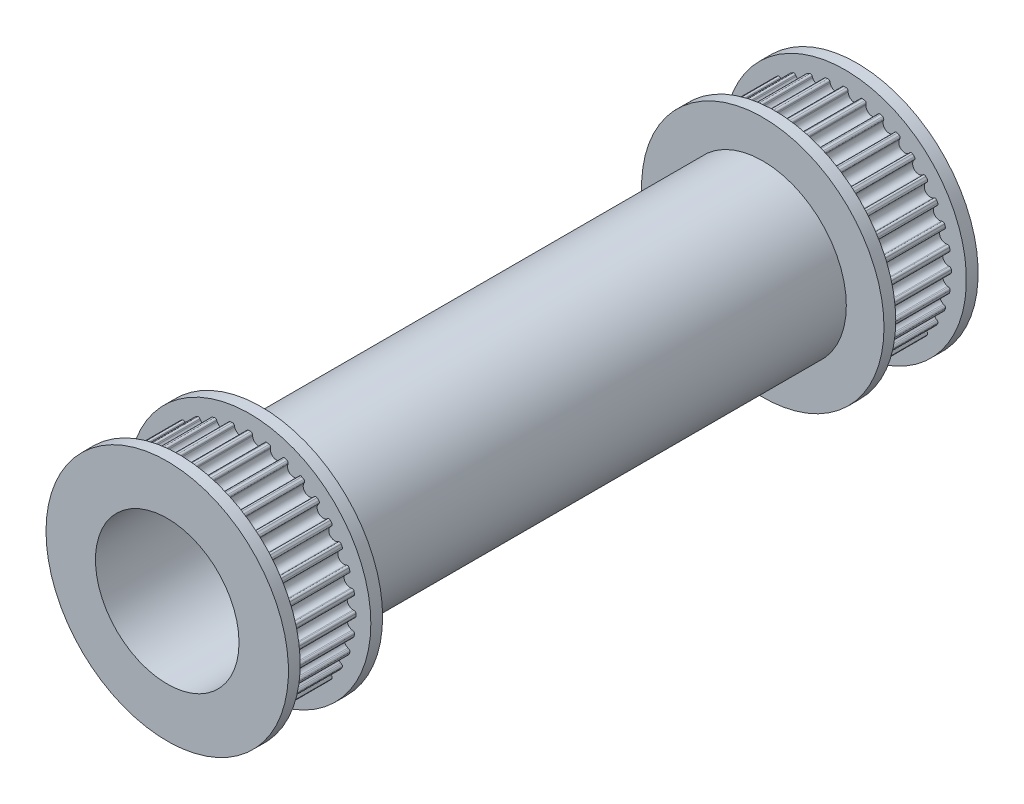
from build123d import *

# Parameters (mm, degrees)
SKETCH2_R             = 45.15
EXTRUDE1_DEPTH        = 30
EXTRUDE2_DEPTH        = 253
CIRPATTERN1_COUNT     = 36
SKETCH6_R             = 35.5
EXTRUDE6_DEPTH        = 223
MIRROR4_COPY_1_DEPTH  = 253
MIRROR4_COPY_2_DEPTH  = 253
MIRROR4_COPY_3_DEPTH  = 253
MIRROR4_COPY_4_DEPTH  = 253
MIRROR4_COPY_5_DEPTH  = 253
MIRROR4_COPY_6_DEPTH  = 253
MIRROR4_COPY_7_DEPTH  = 253
MIRROR4_COPY_8_DEPTH  = 253
MIRROR4_COPY_9_DEPTH  = 253
MIRROR4_COPY_10_DEPTH = 253
MIRROR4_COPY_11_DEPTH = 253
MIRROR4_COPY_12_DEPTH = 253
MIRROR4_COPY_13_DEPTH = 253
MIRROR4_COPY_14_DEPTH = 253
MIRROR4_COPY_15_DEPTH = 253
MIRROR4_COPY_16_DEPTH = 253
MIRROR4_COPY_17_DEPTH = 253
MIRROR4_COPY_18_DEPTH = 253
MIRROR4_COPY_19_DEPTH = 253
MIRROR4_COPY_20_DEPTH = 253
MIRROR4_COPY_21_DEPTH = 253
MIRROR4_COPY_22_DEPTH = 253
MIRROR4_COPY_23_DEPTH = 253
MIRROR4_COPY_24_DEPTH = 253
MIRROR4_COPY_25_DEPTH = 253
MIRROR4_COPY_26_DEPTH = 253
MIRROR4_COPY_27_DEPTH = 253
MIRROR4_COPY_28_DEPTH = 253
MIRROR4_COPY_29_DEPTH = 253
MIRROR4_COPY_30_DEPTH = 253
MIRROR4_COPY_31_DEPTH = 253
MIRROR4_COPY_32_DEPTH = 253
MIRROR4_COPY_33_DEPTH = 253
MIRROR4_COPY_34_DEPTH = 253
MIRROR4_COPY_35_DEPTH = 253
SKETCH7_R             = 51.5
SKETCH7_R_2           = 35.5
EXTRUDE7_DEPTH        = 5
EXTRUDE8_START        = 5
SKETCH8_R             = 51.5
EXTRUDE8_DEPTH        = 5
EXTRUDE11_DEPTH       = 164.605470569
EXTRUDE11_DEPTH_BACK  = 164.605470569
SKETCH11_R            = 30.5


with BuildPart() as part:
    # Sketch2 → Extrude1 (new body)
    with BuildSketch(Plane.XY):
        Circle(SKETCH2_R)
    extrude1 = extrude(amount=EXTRUDE1_DEPTH)

    # Sketch1 → Extrude2 (cut)
    with BuildSketch(Plane.XY):
        with BuildLine():
            Line((-1.265610805, 44.394558923), (-1.282106289, 43.922190055))
            ThreePointArc((-1.282106289, 43.922190055), (-3.626550456, 41.451661388), (-6.364380048, 43.477548716))
            Line((-6.364380048, 43.477548716), (-6.462650922, 43.939876828))
            ThreePointArc((-6.462650922, 43.939876828), (-6.785899963, 44.421956093), (-7.352628199, 44.547293504))
            ThreePointArc((-7.352628199, 44.547293504), (-3.935081785, 44.978190619), (-0.494631081, 45.147290507))
            ThreePointArc((-0.494631081, 45.147290507), (-1.030984829, 44.925445927), (-1.265610805, 44.394558923))
        make_face()
    extrude2 = extrude(amount=EXTRUDE2_DEPTH, mode=Mode.SUBTRACT)

    # CirPattern1: Extrude2 ×36 about axis
    cirpattern1_axis = Axis((0, 0, 0), (0, 0, 1))
    for i in range(1, CIRPATTERN1_COUNT):
        add(extrude2.rotate(cirpattern1_axis, i * 360 / CIRPATTERN1_COUNT), mode=Mode.SUBTRACT)

    # Sketch6 → Extrude6 (add)
    with BuildSketch(Plane.XY.offset(30)):
        with Locations(Location((0, 0, 0), (0, 0, 180))):
            Circle(SKETCH6_R)
    extrude(amount=EXTRUDE6_DEPTH)

    # Mirror4: Extrude1, Extrude2 across plane
    add(extrude1.mirror(Plane.XY.offset(141.5)))
    add(extrude2.mirror(Plane.XY.offset(141.5)), mode=Mode.SUBTRACT)

    # Mirror4 copy 1 sketch → Mirror4 copy 1 (cut)
    with BuildSketch(Plane(origin=(0, 0, 283), x_dir=(0.984807753012208, 0.17364817766693033, 0), z_dir=(0, 0, -1))):
        with BuildLine():
            Line((-1.265610805, -44.394558923), (-1.282106289, -43.922190055))
            ThreePointArc((-1.282106289, -43.922190055), (-3.626550456, -41.451661388), (-6.364380048, -43.477548716))
            Line((-6.364380048, -43.477548716), (-6.462650922, -43.939876828))
            ThreePointArc((-6.462650922, -43.939876828), (-6.785899963, -44.421956093), (-7.352628199, -44.547293504))
            ThreePointArc((-7.352628199, -44.547293504), (-3.935081785, -44.978190619), (-0.494631081, -45.147290507))
            ThreePointArc((-0.494631081, -45.147290507), (-1.030984829, -44.925445927), (-1.265610805, -44.394558923))
        make_face()
    extrude(amount=MIRROR4_COPY_1_DEPTH, mode=Mode.SUBTRACT)

    # Mirror4 copy 2 sketch → Mirror4 copy 2 (cut)
    with BuildSketch(Plane(origin=(0, 0, 283), x_dir=(0.9396926207859084, 0.3420201433256687, 0), z_dir=(0, 0, -1))):
        with BuildLine():
            Line((-1.265610805, -44.394558923), (-1.282106289, -43.922190055))
            ThreePointArc((-1.282106289, -43.922190055), (-3.626550456, -41.451661388), (-6.364380048, -43.477548716))
            Line((-6.364380048, -43.477548716), (-6.462650922, -43.939876828))
            ThreePointArc((-6.462650922, -43.939876828), (-6.785899963, -44.421956093), (-7.352628199, -44.547293504))
            ThreePointArc((-7.352628199, -44.547293504), (-3.935081785, -44.978190619), (-0.494631081, -45.147290507))
            ThreePointArc((-0.494631081, -45.147290507), (-1.030984829, -44.925445927), (-1.265610805, -44.394558923))
        make_face()
    extrude(amount=MIRROR4_COPY_2_DEPTH, mode=Mode.SUBTRACT)

    # Mirror4 copy 3 sketch → Mirror4 copy 3 (cut)
    with BuildSketch(Plane(origin=(0, 0, 283), x_dir=(0.8660254037844387, 0.49999999999999994, 0), z_dir=(0, 0, -1))):
        with BuildLine():
            Line((-1.265610805, -44.394558923), (-1.282106289, -43.922190055))
            ThreePointArc((-1.282106289, -43.922190055), (-3.626550456, -41.451661388), (-6.364380048, -43.477548716))
            Line((-6.364380048, -43.477548716), (-6.462650922, -43.939876828))
            ThreePointArc((-6.462650922, -43.939876828), (-6.785899963, -44.421956093), (-7.352628199, -44.547293504))
            ThreePointArc((-7.352628199, -44.547293504), (-3.935081785, -44.978190619), (-0.494631081, -45.147290507))
            ThreePointArc((-0.494631081, -45.147290507), (-1.030984829, -44.925445927), (-1.265610805, -44.394558923))
        make_face()
    extrude(amount=MIRROR4_COPY_3_DEPTH, mode=Mode.SUBTRACT)

    # Mirror4 copy 4 sketch → Mirror4 copy 4 (cut)
    with BuildSketch(Plane(origin=(0, 0, 283), x_dir=(0.766044443118978, 0.6427876096865393, 0), z_dir=(0, 0, -1))):
        with BuildLine():
            Line((-1.265610805, -44.394558923), (-1.282106289, -43.922190055))
            ThreePointArc((-1.282106289, -43.922190055), (-3.626550456, -41.451661388), (-6.364380048, -43.477548716))
            Line((-6.364380048, -43.477548716), (-6.462650922, -43.939876828))
            ThreePointArc((-6.462650922, -43.939876828), (-6.785899963, -44.421956093), (-7.352628199, -44.547293504))
            ThreePointArc((-7.352628199, -44.547293504), (-3.935081785, -44.978190619), (-0.494631081, -45.147290507))
            ThreePointArc((-0.494631081, -45.147290507), (-1.030984829, -44.925445927), (-1.265610805, -44.394558923))
        make_face()
    extrude(amount=MIRROR4_COPY_4_DEPTH, mode=Mode.SUBTRACT)

    # Mirror4 copy 5 sketch → Mirror4 copy 5 (cut)
    with BuildSketch(Plane(origin=(0, 0, 283), x_dir=(0.6427876096865394, 0.766044443118978, 0), z_dir=(0, 0, -1))):
        with BuildLine():
            Line((-1.265610805, -44.394558923), (-1.282106289, -43.922190055))
            ThreePointArc((-1.282106289, -43.922190055), (-3.626550456, -41.451661388), (-6.364380048, -43.477548716))
            Line((-6.364380048, -43.477548716), (-6.462650922, -43.939876828))
            ThreePointArc((-6.462650922, -43.939876828), (-6.785899963, -44.421956093), (-7.352628199, -44.547293504))
            ThreePointArc((-7.352628199, -44.547293504), (-3.935081785, -44.978190619), (-0.494631081, -45.147290507))
            ThreePointArc((-0.494631081, -45.147290507), (-1.030984829, -44.925445927), (-1.265610805, -44.394558923))
        make_face()
    extrude(amount=MIRROR4_COPY_5_DEPTH, mode=Mode.SUBTRACT)

    # Mirror4 copy 6 sketch → Mirror4 copy 6 (cut)
    with BuildSketch(Plane(origin=(0, 0, 283), x_dir=(0.5000000000000001, 0.8660254037844386, 0), z_dir=(0, 0, -1))):
        with BuildLine():
            Line((-1.265610805, -44.394558923), (-1.282106289, -43.922190055))
            ThreePointArc((-1.282106289, -43.922190055), (-3.626550456, -41.451661388), (-6.364380048, -43.477548716))
            Line((-6.364380048, -43.477548716), (-6.462650922, -43.939876828))
            ThreePointArc((-6.462650922, -43.939876828), (-6.785899963, -44.421956093), (-7.352628199, -44.547293504))
            ThreePointArc((-7.352628199, -44.547293504), (-3.935081785, -44.978190619), (-0.494631081, -45.147290507))
            ThreePointArc((-0.494631081, -45.147290507), (-1.030984829, -44.925445927), (-1.265610805, -44.394558923))
        make_face()
    extrude(amount=MIRROR4_COPY_6_DEPTH, mode=Mode.SUBTRACT)

    # Mirror4 copy 7 sketch → Mirror4 copy 7 (cut)
    with BuildSketch(Plane(origin=(0, 0, 283), x_dir=(0.3420201433256688, 0.9396926207859083, 0), z_dir=(0, 0, -1))):
        with BuildLine():
            Line((-1.265610805, -44.394558923), (-1.282106289, -43.922190055))
            ThreePointArc((-1.282106289, -43.922190055), (-3.626550456, -41.451661388), (-6.364380048, -43.477548716))
            Line((-6.364380048, -43.477548716), (-6.462650922, -43.939876828))
            ThreePointArc((-6.462650922, -43.939876828), (-6.785899963, -44.421956093), (-7.352628199, -44.547293504))
            ThreePointArc((-7.352628199, -44.547293504), (-3.935081785, -44.978190619), (-0.494631081, -45.147290507))
            ThreePointArc((-0.494631081, -45.147290507), (-1.030984829, -44.925445927), (-1.265610805, -44.394558923))
        make_face()
    extrude(amount=MIRROR4_COPY_7_DEPTH, mode=Mode.SUBTRACT)

    # Mirror4 copy 8 sketch → Mirror4 copy 8 (cut)
    with BuildSketch(Plane(origin=(0, 0, 283), x_dir=(0.17364817766693041, 0.984807753012208, 0), z_dir=(0, 0, -1))):
        with BuildLine():
            Line((-1.265610805, -44.394558923), (-1.282106289, -43.922190055))
            ThreePointArc((-1.282106289, -43.922190055), (-3.626550456, -41.451661388), (-6.364380048, -43.477548716))
            Line((-6.364380048, -43.477548716), (-6.462650922, -43.939876828))
            ThreePointArc((-6.462650922, -43.939876828), (-6.785899963, -44.421956093), (-7.352628199, -44.547293504))
            ThreePointArc((-7.352628199, -44.547293504), (-3.935081785, -44.978190619), (-0.494631081, -45.147290507))
            ThreePointArc((-0.494631081, -45.147290507), (-1.030984829, -44.925445927), (-1.265610805, -44.394558923))
        make_face()
    extrude(amount=MIRROR4_COPY_8_DEPTH, mode=Mode.SUBTRACT)

    # Mirror4 copy 9 sketch → Mirror4 copy 9 (cut)
    with BuildSketch(Plane.YX.offset(-283)):
        with BuildLine():
            Line((-1.265610805, -44.394558923), (-1.282106289, -43.922190055))
            ThreePointArc((-1.282106289, -43.922190055), (-3.626550456, -41.451661388), (-6.364380048, -43.477548716))
            Line((-6.364380048, -43.477548716), (-6.462650922, -43.939876828))
            ThreePointArc((-6.462650922, -43.939876828), (-6.785899963, -44.421956093), (-7.352628199, -44.547293504))
            ThreePointArc((-7.352628199, -44.547293504), (-3.935081785, -44.978190619), (-0.494631081, -45.147290507))
            ThreePointArc((-0.494631081, -45.147290507), (-1.030984829, -44.925445927), (-1.265610805, -44.394558923))
        make_face()
    extrude(amount=MIRROR4_COPY_9_DEPTH, mode=Mode.SUBTRACT)

    # Mirror4 copy 10 sketch → Mirror4 copy 10 (cut)
    with BuildSketch(Plane(origin=(0, 0, 283), x_dir=(-0.1736481776669303, 0.984807753012208, 0), z_dir=(0, 0, -1))):
        with BuildLine():
            Line((-1.265610805, -44.394558923), (-1.282106289, -43.922190055))
            ThreePointArc((-1.282106289, -43.922190055), (-3.626550456, -41.451661388), (-6.364380048, -43.477548716))
            Line((-6.364380048, -43.477548716), (-6.462650922, -43.939876828))
            ThreePointArc((-6.462650922, -43.939876828), (-6.785899963, -44.421956093), (-7.352628199, -44.547293504))
            ThreePointArc((-7.352628199, -44.547293504), (-3.935081785, -44.978190619), (-0.494631081, -45.147290507))
            ThreePointArc((-0.494631081, -45.147290507), (-1.030984829, -44.925445927), (-1.265610805, -44.394558923))
        make_face()
    extrude(amount=MIRROR4_COPY_10_DEPTH, mode=Mode.SUBTRACT)

    # Mirror4 copy 11 sketch → Mirror4 copy 11 (cut)
    with BuildSketch(Plane(origin=(0, 0, 283), x_dir=(-0.3420201433256687, 0.9396926207859084, 0), z_dir=(0, 0, -1))):
        with BuildLine():
            Line((-1.265610805, -44.394558923), (-1.282106289, -43.922190055))
            ThreePointArc((-1.282106289, -43.922190055), (-3.626550456, -41.451661388), (-6.364380048, -43.477548716))
            Line((-6.364380048, -43.477548716), (-6.462650922, -43.939876828))
            ThreePointArc((-6.462650922, -43.939876828), (-6.785899963, -44.421956093), (-7.352628199, -44.547293504))
            ThreePointArc((-7.352628199, -44.547293504), (-3.935081785, -44.978190619), (-0.494631081, -45.147290507))
            ThreePointArc((-0.494631081, -45.147290507), (-1.030984829, -44.925445927), (-1.265610805, -44.394558923))
        make_face()
    extrude(amount=MIRROR4_COPY_11_DEPTH, mode=Mode.SUBTRACT)

    # Mirror4 copy 12 sketch → Mirror4 copy 12 (cut)
    with BuildSketch(Plane(origin=(0, 0, 283), x_dir=(-0.4999999999999998, 0.8660254037844387, 0), z_dir=(0, 0, -1))):
        with BuildLine():
            Line((-1.265610805, -44.394558923), (-1.282106289, -43.922190055))
            ThreePointArc((-1.282106289, -43.922190055), (-3.626550456, -41.451661388), (-6.364380048, -43.477548716))
            Line((-6.364380048, -43.477548716), (-6.462650922, -43.939876828))
            ThreePointArc((-6.462650922, -43.939876828), (-6.785899963, -44.421956093), (-7.352628199, -44.547293504))
            ThreePointArc((-7.352628199, -44.547293504), (-3.935081785, -44.978190619), (-0.494631081, -45.147290507))
            ThreePointArc((-0.494631081, -45.147290507), (-1.030984829, -44.925445927), (-1.265610805, -44.394558923))
        make_face()
    extrude(amount=MIRROR4_COPY_12_DEPTH, mode=Mode.SUBTRACT)

    # Mirror4 copy 13 sketch → Mirror4 copy 13 (cut)
    with BuildSketch(Plane(origin=(0, 0, 283), x_dir=(-0.6427876096865394, 0.766044443118978, 0), z_dir=(0, 0, -1))):
        with BuildLine():
            Line((-1.265610805, -44.394558923), (-1.282106289, -43.922190055))
            ThreePointArc((-1.282106289, -43.922190055), (-3.626550456, -41.451661388), (-6.364380048, -43.477548716))
            Line((-6.364380048, -43.477548716), (-6.462650922, -43.939876828))
            ThreePointArc((-6.462650922, -43.939876828), (-6.785899963, -44.421956093), (-7.352628199, -44.547293504))
            ThreePointArc((-7.352628199, -44.547293504), (-3.935081785, -44.978190619), (-0.494631081, -45.147290507))
            ThreePointArc((-0.494631081, -45.147290507), (-1.030984829, -44.925445927), (-1.265610805, -44.394558923))
        make_face()
    extrude(amount=MIRROR4_COPY_13_DEPTH, mode=Mode.SUBTRACT)

    # Mirror4 copy 14 sketch → Mirror4 copy 14 (cut)
    with BuildSketch(Plane(origin=(0, 0, 283), x_dir=(-0.7660444431189779, 0.6427876096865395, 0), z_dir=(0, 0, -1))):
        with BuildLine():
            Line((-1.265610805, -44.394558923), (-1.282106289, -43.922190055))
            ThreePointArc((-1.282106289, -43.922190055), (-3.626550456, -41.451661388), (-6.364380048, -43.477548716))
            Line((-6.364380048, -43.477548716), (-6.462650922, -43.939876828))
            ThreePointArc((-6.462650922, -43.939876828), (-6.785899963, -44.421956093), (-7.352628199, -44.547293504))
            ThreePointArc((-7.352628199, -44.547293504), (-3.935081785, -44.978190619), (-0.494631081, -45.147290507))
            ThreePointArc((-0.494631081, -45.147290507), (-1.030984829, -44.925445927), (-1.265610805, -44.394558923))
        make_face()
    extrude(amount=MIRROR4_COPY_14_DEPTH, mode=Mode.SUBTRACT)

    # Mirror4 copy 15 sketch → Mirror4 copy 15 (cut)
    with BuildSketch(Plane(origin=(0, 0, 283), x_dir=(-0.8660254037844387, 0.49999999999999994, 0), z_dir=(0, 0, -1))):
        with BuildLine():
            Line((-1.265610805, -44.394558923), (-1.282106289, -43.922190055))
            ThreePointArc((-1.282106289, -43.922190055), (-3.626550456, -41.451661388), (-6.364380048, -43.477548716))
            Line((-6.364380048, -43.477548716), (-6.462650922, -43.939876828))
            ThreePointArc((-6.462650922, -43.939876828), (-6.785899963, -44.421956093), (-7.352628199, -44.547293504))
            ThreePointArc((-7.352628199, -44.547293504), (-3.935081785, -44.978190619), (-0.494631081, -45.147290507))
            ThreePointArc((-0.494631081, -45.147290507), (-1.030984829, -44.925445927), (-1.265610805, -44.394558923))
        make_face()
    extrude(amount=MIRROR4_COPY_15_DEPTH, mode=Mode.SUBTRACT)

    # Mirror4 copy 16 sketch → Mirror4 copy 16 (cut)
    with BuildSketch(Plane(origin=(0, 0, 283), x_dir=(-0.9396926207859083, 0.3420201433256689, 0), z_dir=(0, 0, -1))):
        with BuildLine():
            Line((-1.265610805, -44.394558923), (-1.282106289, -43.922190055))
            ThreePointArc((-1.282106289, -43.922190055), (-3.626550456, -41.451661388), (-6.364380048, -43.477548716))
            Line((-6.364380048, -43.477548716), (-6.462650922, -43.939876828))
            ThreePointArc((-6.462650922, -43.939876828), (-6.785899963, -44.421956093), (-7.352628199, -44.547293504))
            ThreePointArc((-7.352628199, -44.547293504), (-3.935081785, -44.978190619), (-0.494631081, -45.147290507))
            ThreePointArc((-0.494631081, -45.147290507), (-1.030984829, -44.925445927), (-1.265610805, -44.394558923))
        make_face()
    extrude(amount=MIRROR4_COPY_16_DEPTH, mode=Mode.SUBTRACT)

    # Mirror4 copy 17 sketch → Mirror4 copy 17 (cut)
    with BuildSketch(Plane(origin=(0, 0, 283), x_dir=(-0.984807753012208, 0.17364817766693028, 0), z_dir=(0, 0, -1))):
        with BuildLine():
            Line((-1.265610805, -44.394558923), (-1.282106289, -43.922190055))
            ThreePointArc((-1.282106289, -43.922190055), (-3.626550456, -41.451661388), (-6.364380048, -43.477548716))
            Line((-6.364380048, -43.477548716), (-6.462650922, -43.939876828))
            ThreePointArc((-6.462650922, -43.939876828), (-6.785899963, -44.421956093), (-7.352628199, -44.547293504))
            ThreePointArc((-7.352628199, -44.547293504), (-3.935081785, -44.978190619), (-0.494631081, -45.147290507))
            ThreePointArc((-0.494631081, -45.147290507), (-1.030984829, -44.925445927), (-1.265610805, -44.394558923))
        make_face()
    extrude(amount=MIRROR4_COPY_17_DEPTH, mode=Mode.SUBTRACT)

    # Mirror4 copy 18 sketch → Mirror4 copy 18 (cut)
    with BuildSketch(Plane(origin=(0, 0, 283), x_dir=(-1, 0, 0), z_dir=(0, 0, -1))):
        with BuildLine():
            Line((-1.265610805, -44.394558923), (-1.282106289, -43.922190055))
            ThreePointArc((-1.282106289, -43.922190055), (-3.626550456, -41.451661388), (-6.364380048, -43.477548716))
            Line((-6.364380048, -43.477548716), (-6.462650922, -43.939876828))
            ThreePointArc((-6.462650922, -43.939876828), (-6.785899963, -44.421956093), (-7.352628199, -44.547293504))
            ThreePointArc((-7.352628199, -44.547293504), (-3.935081785, -44.978190619), (-0.494631081, -45.147290507))
            ThreePointArc((-0.494631081, -45.147290507), (-1.030984829, -44.925445927), (-1.265610805, -44.394558923))
        make_face()
    extrude(amount=MIRROR4_COPY_18_DEPTH, mode=Mode.SUBTRACT)

    # Mirror4 copy 19 sketch → Mirror4 copy 19 (cut)
    with BuildSketch(Plane(origin=(0, 0, 283), x_dir=(-0.984807753012208, -0.17364817766693047, 0), z_dir=(0, 0, -1))):
        with BuildLine():
            Line((-1.265610805, -44.394558923), (-1.282106289, -43.922190055))
            ThreePointArc((-1.282106289, -43.922190055), (-3.626550456, -41.451661388), (-6.364380048, -43.477548716))
            Line((-6.364380048, -43.477548716), (-6.462650922, -43.939876828))
            ThreePointArc((-6.462650922, -43.939876828), (-6.785899963, -44.421956093), (-7.352628199, -44.547293504))
            ThreePointArc((-7.352628199, -44.547293504), (-3.935081785, -44.978190619), (-0.494631081, -45.147290507))
            ThreePointArc((-0.494631081, -45.147290507), (-1.030984829, -44.925445927), (-1.265610805, -44.394558923))
        make_face()
    extrude(amount=MIRROR4_COPY_19_DEPTH, mode=Mode.SUBTRACT)

    # Mirror4 copy 20 sketch → Mirror4 copy 20 (cut)
    with BuildSketch(Plane(origin=(0, 0, 283), x_dir=(-0.9396926207859084, -0.34202014332566866, 0), z_dir=(0, 0, -1))):
        with BuildLine():
            Line((-1.265610805, -44.394558923), (-1.282106289, -43.922190055))
            ThreePointArc((-1.282106289, -43.922190055), (-3.626550456, -41.451661388), (-6.364380048, -43.477548716))
            Line((-6.364380048, -43.477548716), (-6.462650922, -43.939876828))
            ThreePointArc((-6.462650922, -43.939876828), (-6.785899963, -44.421956093), (-7.352628199, -44.547293504))
            ThreePointArc((-7.352628199, -44.547293504), (-3.935081785, -44.978190619), (-0.494631081, -45.147290507))
            ThreePointArc((-0.494631081, -45.147290507), (-1.030984829, -44.925445927), (-1.265610805, -44.394558923))
        make_face()
    extrude(amount=MIRROR4_COPY_20_DEPTH, mode=Mode.SUBTRACT)

    # Mirror4 copy 21 sketch → Mirror4 copy 21 (cut)
    with BuildSketch(Plane(origin=(0, 0, 283), x_dir=(-0.8660254037844386, -0.5000000000000001, 0), z_dir=(0, 0, -1))):
        with BuildLine():
            Line((-1.265610805, -44.394558923), (-1.282106289, -43.922190055))
            ThreePointArc((-1.282106289, -43.922190055), (-3.626550456, -41.451661388), (-6.364380048, -43.477548716))
            Line((-6.364380048, -43.477548716), (-6.462650922, -43.939876828))
            ThreePointArc((-6.462650922, -43.939876828), (-6.785899963, -44.421956093), (-7.352628199, -44.547293504))
            ThreePointArc((-7.352628199, -44.547293504), (-3.935081785, -44.978190619), (-0.494631081, -45.147290507))
            ThreePointArc((-0.494631081, -45.147290507), (-1.030984829, -44.925445927), (-1.265610805, -44.394558923))
        make_face()
    extrude(amount=MIRROR4_COPY_21_DEPTH, mode=Mode.SUBTRACT)

    # Mirror4 copy 22 sketch → Mirror4 copy 22 (cut)
    with BuildSketch(Plane(origin=(0, 0, 283), x_dir=(-0.766044443118978, -0.6427876096865393, 0), z_dir=(0, 0, -1))):
        with BuildLine():
            Line((-1.265610805, -44.394558923), (-1.282106289, -43.922190055))
            ThreePointArc((-1.282106289, -43.922190055), (-3.626550456, -41.451661388), (-6.364380048, -43.477548716))
            Line((-6.364380048, -43.477548716), (-6.462650922, -43.939876828))
            ThreePointArc((-6.462650922, -43.939876828), (-6.785899963, -44.421956093), (-7.352628199, -44.547293504))
            ThreePointArc((-7.352628199, -44.547293504), (-3.935081785, -44.978190619), (-0.494631081, -45.147290507))
            ThreePointArc((-0.494631081, -45.147290507), (-1.030984829, -44.925445927), (-1.265610805, -44.394558923))
        make_face()
    extrude(amount=MIRROR4_COPY_22_DEPTH, mode=Mode.SUBTRACT)

    # Mirror4 copy 23 sketch → Mirror4 copy 23 (cut)
    with BuildSketch(Plane(origin=(0, 0, 283), x_dir=(-0.6427876096865395, -0.7660444431189779, 0), z_dir=(0, 0, -1))):
        with BuildLine():
            Line((-1.265610805, -44.394558923), (-1.282106289, -43.922190055))
            ThreePointArc((-1.282106289, -43.922190055), (-3.626550456, -41.451661388), (-6.364380048, -43.477548716))
            Line((-6.364380048, -43.477548716), (-6.462650922, -43.939876828))
            ThreePointArc((-6.462650922, -43.939876828), (-6.785899963, -44.421956093), (-7.352628199, -44.547293504))
            ThreePointArc((-7.352628199, -44.547293504), (-3.935081785, -44.978190619), (-0.494631081, -45.147290507))
            ThreePointArc((-0.494631081, -45.147290507), (-1.030984829, -44.925445927), (-1.265610805, -44.394558923))
        make_face()
    extrude(amount=MIRROR4_COPY_23_DEPTH, mode=Mode.SUBTRACT)

    # Mirror4 copy 24 sketch → Mirror4 copy 24 (cut)
    with BuildSketch(Plane(origin=(0, 0, 283), x_dir=(-0.5000000000000004, -0.8660254037844384, 0), z_dir=(0, 0, -1))):
        with BuildLine():
            Line((-1.265610805, -44.394558923), (-1.282106289, -43.922190055))
            ThreePointArc((-1.282106289, -43.922190055), (-3.626550456, -41.451661388), (-6.364380048, -43.477548716))
            Line((-6.364380048, -43.477548716), (-6.462650922, -43.939876828))
            ThreePointArc((-6.462650922, -43.939876828), (-6.785899963, -44.421956093), (-7.352628199, -44.547293504))
            ThreePointArc((-7.352628199, -44.547293504), (-3.935081785, -44.978190619), (-0.494631081, -45.147290507))
            ThreePointArc((-0.494631081, -45.147290507), (-1.030984829, -44.925445927), (-1.265610805, -44.394558923))
        make_face()
    extrude(amount=MIRROR4_COPY_24_DEPTH, mode=Mode.SUBTRACT)

    # Mirror4 copy 25 sketch → Mirror4 copy 25 (cut)
    with BuildSketch(Plane(origin=(0, 0, 283), x_dir=(-0.34202014332566855, -0.9396926207859084, 0), z_dir=(0, 0, -1))):
        with BuildLine():
            Line((-1.265610805, -44.394558923), (-1.282106289, -43.922190055))
            ThreePointArc((-1.282106289, -43.922190055), (-3.626550456, -41.451661388), (-6.364380048, -43.477548716))
            Line((-6.364380048, -43.477548716), (-6.462650922, -43.939876828))
            ThreePointArc((-6.462650922, -43.939876828), (-6.785899963, -44.421956093), (-7.352628199, -44.547293504))
            ThreePointArc((-7.352628199, -44.547293504), (-3.935081785, -44.978190619), (-0.494631081, -45.147290507))
            ThreePointArc((-0.494631081, -45.147290507), (-1.030984829, -44.925445927), (-1.265610805, -44.394558923))
        make_face()
    extrude(amount=MIRROR4_COPY_25_DEPTH, mode=Mode.SUBTRACT)

    # Mirror4 copy 26 sketch → Mirror4 copy 26 (cut)
    with BuildSketch(Plane(origin=(0, 0, 283), x_dir=(-0.17364817766693033, -0.984807753012208, 0), z_dir=(0, 0, -1))):
        with BuildLine():
            Line((-1.265610805, -44.394558923), (-1.282106289, -43.922190055))
            ThreePointArc((-1.282106289, -43.922190055), (-3.626550456, -41.451661388), (-6.364380048, -43.477548716))
            Line((-6.364380048, -43.477548716), (-6.462650922, -43.939876828))
            ThreePointArc((-6.462650922, -43.939876828), (-6.785899963, -44.421956093), (-7.352628199, -44.547293504))
            ThreePointArc((-7.352628199, -44.547293504), (-3.935081785, -44.978190619), (-0.494631081, -45.147290507))
            ThreePointArc((-0.494631081, -45.147290507), (-1.030984829, -44.925445927), (-1.265610805, -44.394558923))
        make_face()
    extrude(amount=MIRROR4_COPY_26_DEPTH, mode=Mode.SUBTRACT)

    # Mirror4 copy 27 sketch → Mirror4 copy 27 (cut)
    with BuildSketch(Plane(origin=(0, 0, 283), x_dir=(0, -1, 0), z_dir=(0, 0, -1))):
        with BuildLine():
            Line((-1.265610805, -44.394558923), (-1.282106289, -43.922190055))
            ThreePointArc((-1.282106289, -43.922190055), (-3.626550456, -41.451661388), (-6.364380048, -43.477548716))
            Line((-6.364380048, -43.477548716), (-6.462650922, -43.939876828))
            ThreePointArc((-6.462650922, -43.939876828), (-6.785899963, -44.421956093), (-7.352628199, -44.547293504))
            ThreePointArc((-7.352628199, -44.547293504), (-3.935081785, -44.978190619), (-0.494631081, -45.147290507))
            ThreePointArc((-0.494631081, -45.147290507), (-1.030984829, -44.925445927), (-1.265610805, -44.394558923))
        make_face()
    extrude(amount=MIRROR4_COPY_27_DEPTH, mode=Mode.SUBTRACT)

    # Mirror4 copy 28 sketch → Mirror4 copy 28 (cut)
    with BuildSketch(Plane(origin=(0, 0, 283), x_dir=(0.17364817766692997, -0.9848077530122081, 0), z_dir=(0, 0, -1))):
        with BuildLine():
            Line((-1.265610805, -44.394558923), (-1.282106289, -43.922190055))
            ThreePointArc((-1.282106289, -43.922190055), (-3.626550456, -41.451661388), (-6.364380048, -43.477548716))
            Line((-6.364380048, -43.477548716), (-6.462650922, -43.939876828))
            ThreePointArc((-6.462650922, -43.939876828), (-6.785899963, -44.421956093), (-7.352628199, -44.547293504))
            ThreePointArc((-7.352628199, -44.547293504), (-3.935081785, -44.978190619), (-0.494631081, -45.147290507))
            ThreePointArc((-0.494631081, -45.147290507), (-1.030984829, -44.925445927), (-1.265610805, -44.394558923))
        make_face()
    extrude(amount=MIRROR4_COPY_28_DEPTH, mode=Mode.SUBTRACT)

    # Mirror4 copy 29 sketch → Mirror4 copy 29 (cut)
    with BuildSketch(Plane(origin=(0, 0, 283), x_dir=(0.342020143325669, -0.9396926207859083, 0), z_dir=(0, 0, -1))):
        with BuildLine():
            Line((-1.265610805, -44.394558923), (-1.282106289, -43.922190055))
            ThreePointArc((-1.282106289, -43.922190055), (-3.626550456, -41.451661388), (-6.364380048, -43.477548716))
            Line((-6.364380048, -43.477548716), (-6.462650922, -43.939876828))
            ThreePointArc((-6.462650922, -43.939876828), (-6.785899963, -44.421956093), (-7.352628199, -44.547293504))
            ThreePointArc((-7.352628199, -44.547293504), (-3.935081785, -44.978190619), (-0.494631081, -45.147290507))
            ThreePointArc((-0.494631081, -45.147290507), (-1.030984829, -44.925445927), (-1.265610805, -44.394558923))
        make_face()
    extrude(amount=MIRROR4_COPY_29_DEPTH, mode=Mode.SUBTRACT)

    # Mirror4 copy 30 sketch → Mirror4 copy 30 (cut)
    with BuildSketch(Plane(origin=(0, 0, 283), x_dir=(0.5000000000000001, -0.8660254037844386, 0), z_dir=(0, 0, -1))):
        with BuildLine():
            Line((-1.265610805, -44.394558923), (-1.282106289, -43.922190055))
            ThreePointArc((-1.282106289, -43.922190055), (-3.626550456, -41.451661388), (-6.364380048, -43.477548716))
            Line((-6.364380048, -43.477548716), (-6.462650922, -43.939876828))
            ThreePointArc((-6.462650922, -43.939876828), (-6.785899963, -44.421956093), (-7.352628199, -44.547293504))
            ThreePointArc((-7.352628199, -44.547293504), (-3.935081785, -44.978190619), (-0.494631081, -45.147290507))
            ThreePointArc((-0.494631081, -45.147290507), (-1.030984829, -44.925445927), (-1.265610805, -44.394558923))
        make_face()
    extrude(amount=MIRROR4_COPY_30_DEPTH, mode=Mode.SUBTRACT)

    # Mirror4 copy 31 sketch → Mirror4 copy 31 (cut)
    with BuildSketch(Plane(origin=(0, 0, 283), x_dir=(0.6427876096865393, -0.7660444431189781, 0), z_dir=(0, 0, -1))):
        with BuildLine():
            Line((-1.265610805, -44.394558923), (-1.282106289, -43.922190055))
            ThreePointArc((-1.282106289, -43.922190055), (-3.626550456, -41.451661388), (-6.364380048, -43.477548716))
            Line((-6.364380048, -43.477548716), (-6.462650922, -43.939876828))
            ThreePointArc((-6.462650922, -43.939876828), (-6.785899963, -44.421956093), (-7.352628199, -44.547293504))
            ThreePointArc((-7.352628199, -44.547293504), (-3.935081785, -44.978190619), (-0.494631081, -45.147290507))
            ThreePointArc((-0.494631081, -45.147290507), (-1.030984829, -44.925445927), (-1.265610805, -44.394558923))
        make_face()
    extrude(amount=MIRROR4_COPY_31_DEPTH, mode=Mode.SUBTRACT)

    # Mirror4 copy 32 sketch → Mirror4 copy 32 (cut)
    with BuildSketch(Plane(origin=(0, 0, 283), x_dir=(0.7660444431189778, -0.6427876096865396, 0), z_dir=(0, 0, -1))):
        with BuildLine():
            Line((-1.265610805, -44.394558923), (-1.282106289, -43.922190055))
            ThreePointArc((-1.282106289, -43.922190055), (-3.626550456, -41.451661388), (-6.364380048, -43.477548716))
            Line((-6.364380048, -43.477548716), (-6.462650922, -43.939876828))
            ThreePointArc((-6.462650922, -43.939876828), (-6.785899963, -44.421956093), (-7.352628199, -44.547293504))
            ThreePointArc((-7.352628199, -44.547293504), (-3.935081785, -44.978190619), (-0.494631081, -45.147290507))
            ThreePointArc((-0.494631081, -45.147290507), (-1.030984829, -44.925445927), (-1.265610805, -44.394558923))
        make_face()
    extrude(amount=MIRROR4_COPY_32_DEPTH, mode=Mode.SUBTRACT)

    # Mirror4 copy 33 sketch → Mirror4 copy 33 (cut)
    with BuildSketch(Plane(origin=(0, 0, 283), x_dir=(0.8660254037844384, -0.5000000000000004, 0), z_dir=(0, 0, -1))):
        with BuildLine():
            Line((-1.265610805, -44.394558923), (-1.282106289, -43.922190055))
            ThreePointArc((-1.282106289, -43.922190055), (-3.626550456, -41.451661388), (-6.364380048, -43.477548716))
            Line((-6.364380048, -43.477548716), (-6.462650922, -43.939876828))
            ThreePointArc((-6.462650922, -43.939876828), (-6.785899963, -44.421956093), (-7.352628199, -44.547293504))
            ThreePointArc((-7.352628199, -44.547293504), (-3.935081785, -44.978190619), (-0.494631081, -45.147290507))
            ThreePointArc((-0.494631081, -45.147290507), (-1.030984829, -44.925445927), (-1.265610805, -44.394558923))
        make_face()
    extrude(amount=MIRROR4_COPY_33_DEPTH, mode=Mode.SUBTRACT)

    # Mirror4 copy 34 sketch → Mirror4 copy 34 (cut)
    with BuildSketch(Plane(origin=(0, 0, 283), x_dir=(0.9396926207859084, -0.3420201433256686, 0), z_dir=(0, 0, -1))):
        with BuildLine():
            Line((-1.265610805, -44.394558923), (-1.282106289, -43.922190055))
            ThreePointArc((-1.282106289, -43.922190055), (-3.626550456, -41.451661388), (-6.364380048, -43.477548716))
            Line((-6.364380048, -43.477548716), (-6.462650922, -43.939876828))
            ThreePointArc((-6.462650922, -43.939876828), (-6.785899963, -44.421956093), (-7.352628199, -44.547293504))
            ThreePointArc((-7.352628199, -44.547293504), (-3.935081785, -44.978190619), (-0.494631081, -45.147290507))
            ThreePointArc((-0.494631081, -45.147290507), (-1.030984829, -44.925445927), (-1.265610805, -44.394558923))
        make_face()
    extrude(amount=MIRROR4_COPY_34_DEPTH, mode=Mode.SUBTRACT)

    # Mirror4 copy 35 sketch → Mirror4 copy 35 (cut)
    with BuildSketch(Plane(origin=(0, 0, 283), x_dir=(0.984807753012208, -0.1736481776669304, 0), z_dir=(0, 0, -1))):
        with BuildLine():
            Line((-1.265610805, -44.394558923), (-1.282106289, -43.922190055))
            ThreePointArc((-1.282106289, -43.922190055), (-3.626550456, -41.451661388), (-6.364380048, -43.477548716))
            Line((-6.364380048, -43.477548716), (-6.462650922, -43.939876828))
            ThreePointArc((-6.462650922, -43.939876828), (-6.785899963, -44.421956093), (-7.352628199, -44.547293504))
            ThreePointArc((-7.352628199, -44.547293504), (-3.935081785, -44.978190619), (-0.494631081, -45.147290507))
            ThreePointArc((-0.494631081, -45.147290507), (-1.030984829, -44.925445927), (-1.265610805, -44.394558923))
        make_face()
    extrude(amount=MIRROR4_COPY_35_DEPTH, mode=Mode.SUBTRACT)

    # Sketch7 → Extrude7 (add)
    with BuildSketch(Plane.XY.offset(30)):
        Circle(SKETCH7_R)
        with Locations(Location((0, 0, 0), (0, 0, 180))):
            Circle(SKETCH7_R_2, mode=Mode.SUBTRACT)
    extrude7 = extrude(amount=EXTRUDE7_DEPTH)

    # Sketch8 → Extrude8 (add)
    with BuildSketch(Plane(origin=(0, 0, 0), x_dir=(-1, 0, 0), z_dir=(0, 0, -1)).offset(EXTRUDE8_START)):
        with Locations(Location((0, 0, 0), (0, 0, 180))):
            Circle(SKETCH8_R)
    extrude8 = extrude(amount=-EXTRUDE8_DEPTH)

    # Mirror5: Extrude7, Extrude8 across plane
    add(extrude7.mirror(Plane.XY.offset(141.5)))
    add(extrude8.mirror(Plane.XY.offset(141.5)))

    # Sketch11 → Extrude11 (cut, two sides: drawn at the far end of the back side and taken through both)
    with BuildSketch(Plane.XY.offset(141.5).offset(-EXTRUDE11_DEPTH_BACK)):
        Circle(SKETCH11_R)
    extrude(amount=EXTRUDE11_DEPTH + EXTRUDE11_DEPTH_BACK, mode=Mode.SUBTRACT)


solid = part.part
